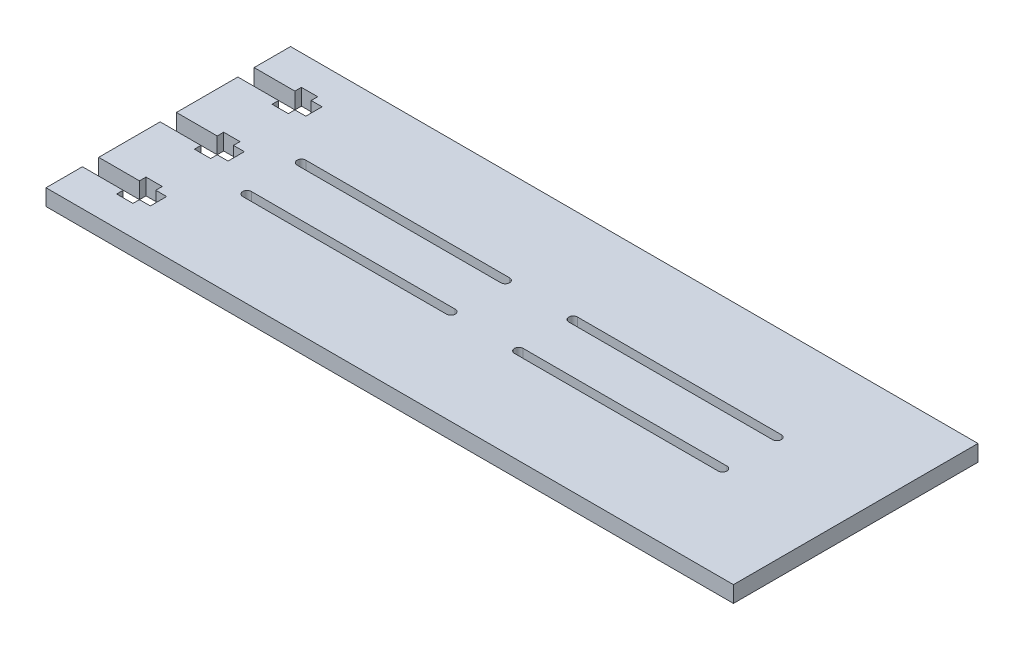
from build123d import *

# Parameters (mm, degrees)
SKETCH1_W           = 253
SKETCH1_H           = 90
BOSS_EXTRUDE1_DEPTH = 6
CUT_EXTRUDE1_DEPTH  = 135.399590773
CUT_EXTRUDE2_DEPTH  = 135.399590773


with BuildPart() as part:
    # Sketch1 → Boss-Extrude1 (new body)
    with BuildSketch(Plane(origin=(0, 0, 0), x_dir=(1, 0, 0), z_dir=(0, 1, 0))):
        Rectangle(SKETCH1_W, SKETCH1_H)
    extrude(amount=BOSS_EXTRUDE1_DEPTH)

    # Sketch2 → Cut-Extrude1 (cut, through all)
    with BuildSketch(Plane.XZ):
        with BuildLine():
            Line((87.5, 8.4), (12.5, 8.4))
            ThreePointArc((12.5, 8.4), (10.9, 10), (12.5, 11.6))
            Line((12.5, 11.6), (87.5, 11.6))
            ThreePointArc((87.5, 11.6), (89.1, 10), (87.5, 8.4))
        make_face()
        with BuildLine():
            Line((-12.5, 8.4), (-87.5, 8.4))
            ThreePointArc((-87.5, 8.4), (-89.1, 10), (-87.5, 11.6))
            Line((-87.5, 11.6), (-12.5, 11.6))
            ThreePointArc((-12.5, 11.6), (-10.9, 10), (-12.5, 8.4))
        make_face()
        with BuildLine():
            Line((87.5, -11.6), (12.5, -11.6))
            ThreePointArc((12.5, -11.6), (10.9, -10), (12.5, -8.4))
            Line((12.5, -8.4), (87.5, -8.4))
            ThreePointArc((87.5, -8.4), (89.1, -10), (87.5, -11.6))
        make_face()
        with BuildLine():
            Line((-12.5, -11.6), (-87.5, -11.6))
            ThreePointArc((-87.5, -11.6), (-89.1, -10), (-87.5, -8.4))
            Line((-87.5, -8.4), (-12.5, -8.4))
            ThreePointArc((-12.5, -8.4), (-10.9, -10), (-12.5, -11.6))
        make_face()
    extrude(amount=-CUT_EXTRUDE1_DEPTH, mode=Mode.SUBTRACT)

    # Sketch3 → Cut-Extrude2 (cut, through all)
    with BuildSketch(Plane(origin=(0, 6, 0), x_dir=(1, 0, 0), z_dir=(0, 1, 0))):
        Polygon((-126.5, -3), (-111.5, -3), (-111.5, -5.4), (-105.5, -5.4), (-105.5, -3), (-101.5, -3), (-101.5, 3), (-105.5, 3), (-105.5, 5.4), (-111.5, 5.4), (-111.5, 3), (-126.5, 3), align=None)
        Polygon((-126.5, 25.6), (-111.5, 25.6), (-111.5, 23.2), (-105.5, 23.2), (-105.5, 25.6), (-101.5, 25.6), (-101.5, 31.6), (-105.5, 31.6), (-105.5, 34), (-111.5, 34), (-111.5, 31.6), (-126.5, 31.6), align=None)
        Polygon((-111.5, -31.6), (-111.5, -34), (-105.5, -34), (-105.5, -31.6), (-101.5, -31.6), (-101.5, -25.6), (-105.5, -25.6), (-105.5, -23.2), (-111.5, -23.2), (-111.5, -25.6), (-126.5, -25.6), (-126.5, -31.6), align=None)
    extrude(amount=-CUT_EXTRUDE2_DEPTH, mode=Mode.SUBTRACT)


solid = part.part
